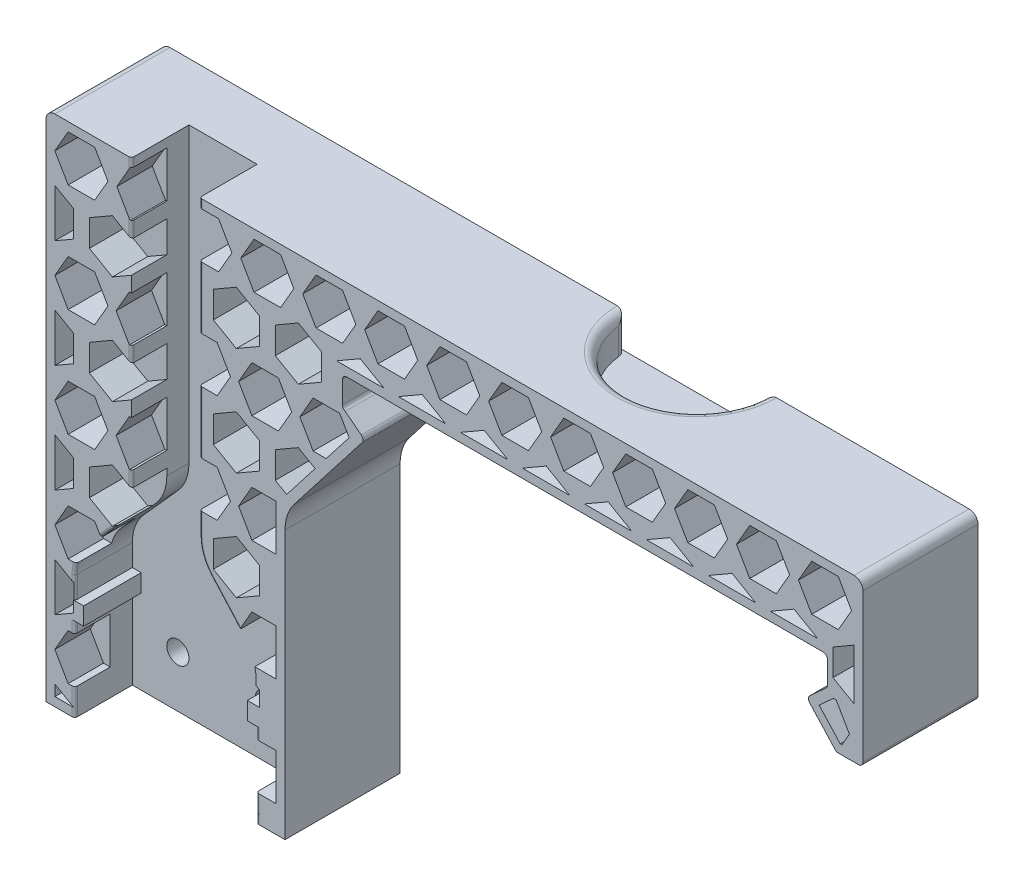
from build123d import *

# Parameters (mm, degrees)
BOSS_EXTRUDE1_DEPTH = 6.5
SKETCH3_R           = 1.25
CUT_EXTRUDE1_DEPTH  = 6.5
CUT_EXTRUDE4_DEPTH  = 4
BOSS_EXTRUDE2_DEPTH = 4
CUT_EXTRUDE5_DEPTH  = 4
FILLET3_R           = 1
FILLET5_R           = 0.3
SKETCH7_R           = 1.25
CUT_EXTRUDE6_DEPTH  = 10


with BuildPart() as part:
    # Sketch1 → Boss-Extrude1 (new, symmetric)
    with BuildSketch(Plane.XY):
        with BuildLine():
            Line((-19.159188309, 3.131905105), (34.640811691, 3.131905105))
            ThreePointArc((34.640811691, 3.131905105), (34.994365081, 2.985458495), (35.140811691, 2.631905105))
            Line((35.140811691, 2.631905105), (35.140811691, 0.151900089))
            ThreePointArc((35.140811691, 0.151900089), (35.098470899, -0.049465372), (34.978619495, -0.216726941))
            Line((34.978619495, -0.216726941), (33.150225729, -1.89225704))
            ThreePointArc((33.150225729, -1.89225704), (32.988508672, -2.239091587), (33.119406504, -2.598691874))
            Line((33.119406504, -2.598691874), (35.992179645, -5.733556779))
            ThreePointArc((35.992179645, -5.733556779), (36.159441214, -5.853408183), (36.360806675, -5.895748974))
            Line((36.360806675, -5.895748974), (38.640811691, -5.895748974))
            ThreePointArc((38.640811691, -5.895748974), (38.994365081, -5.749302365), (39.140811691, -5.395748974))
            Line((39.140811691, -5.395748974), (39.140811691, 11.375776068))
            ThreePointArc((39.140811691, 11.375776068), (38.847918472, 12.082882849), (38.140811691, 12.375776068))
            Line((38.140811691, 12.375776068), (-38.140811691, 12.375776068))
            Line((-38.140811691, 12.375776068), (-52.140811691, 12.375776068))
            ThreePointArc((-52.140811691, 12.375776068), (-52.847918472, 12.082882849), (-53.140811691, 11.375776068))
            Line((-53.140811691, 11.375776068), (-53.140811691, -45.624223932))
            Line((-53.140811691, -45.624223932), (-50.140811691, -45.624223932))
            Line((-50.140811691, -45.624223932), (-26.140811691, -45.624223932))
            Line((-26.140811691, -45.624223932), (-26.140811691, -15.3408971))
            ThreePointArc((-26.140811691, -15.3408971), (-25.870619915, -13.719504438), (-25.089246025, -12.273346562))
            Line((-25.089246025, -12.273346562), (-17.438945389, -2.426170674))
            ThreePointArc((-17.438945389, -2.426170674), (-17.337683774, -2.057127729), (-17.527033769, -1.724572186))
            Line((-17.527033769, -1.724572186), (-19.344726867, -0.312400938))
            ThreePointArc((-19.344726867, -0.312400938), (-19.573174589, -0.12848422), (-19.659188309, 0.151900089))
            Line((-19.659188309, 0.151900089), (-19.659188309, 2.631905105))
            ThreePointArc((-19.659188309, 2.631905105), (-19.5127417, 2.985458495), (-19.159188309, 3.131905105))
        make_face()
    extrude(amount=BOSS_EXTRUDE1_DEPTH, both=True)

    # Sketch3 → Cut-Extrude1 (cut)
    with BuildSketch(Plane.XY.offset(6.5)):
        with BuildLine():
            Line((-49.890811691, -36.124223932), (-49.890811691, -45.624223932))
            Line((-49.890811691, -45.624223932), (-29.390811691, -45.624223932))
            Line((-29.390811691, -45.624223932), (-29.390811691, -36.124223932))
            Line((-29.390811691, -36.124223932), (-30.390811691, -36.124223932))
            Line((-30.390811691, -36.124223932), (-30.390811691, -34.124223932))
            Line((-30.390811691, -34.124223932), (-29.390811691, -34.124223932))
            Line((-29.390811691, -34.124223932), (-29.390811691, -31.678365039))
            ThreePointArc((-29.390811691, -31.678365039), (-29.72081053, -29.892003049), (-30.667247356, -28.341440011))
            Line((-30.667247356, -28.341440011), (-34.514376026, -24.048556297))
            ThreePointArc((-34.514376026, -24.048556297), (-35.460812851, -22.49799326), (-35.790811691, -20.711631269))
            Line((-35.790811691, -20.711631269), (-35.790811691, 12.375776068))
            Line((-35.790811691, 12.375776068), (-43.490811691, 12.375776068))
            Line((-43.490811691, 12.375776068), (-43.490811691, -20.711631269))
            ThreePointArc((-43.490811691, -20.711631269), (-43.82081053, -22.49799326), (-44.767247356, -24.048556297))
            Line((-44.767247356, -24.048556297), (-48.614376026, -28.341440011))
            ThreePointArc((-48.614376026, -28.341440011), (-49.560812851, -29.892003049), (-49.890811691, -31.678365039))
            Line((-49.890811691, -31.678365039), (-49.890811691, -34.124223932))
            Line((-49.890811691, -34.124223932), (-48.890811691, -34.124223932))
            Line((-48.890811691, -34.124223932), (-48.890811691, -36.124223932))
            Line((-48.890811691, -36.124223932), (-49.890811691, -36.124223932))
        make_face()
        with Locations((-44.740811691, -39.824223932)):
            Circle(SKETCH3_R, mode=Mode.SUBTRACT)
        with Locations((-34.740811691, -39.824223932)):
            Circle(SKETCH3_R, mode=Mode.SUBTRACT)
    extrude(amount=-CUT_EXTRUDE1_DEPTH, mode=Mode.SUBTRACT)

    # Sketch2 → Cut-Extrude4 (cut)
    with BuildSketch(Plane.XY.offset(6.5)):
        Polygon((-34.238887902, -44.604986045), (-34.238887902, -44.624223932), (-29.042735479, -44.624223932), (-29.042735479, -44.604986045), (-31.640811691, -43.104986045), align=None)
        Polygon((-41.238887902, -44.604986045), (-41.238887902, -44.624223932), (-36.042735479, -44.624223932), (-36.042735479, -44.604986045), (-38.640811691, -43.104986045), align=None)
        Polygon((-48.238887902, -44.604986045), (-48.238887902, -44.624223932), (-43.042735479, -44.624223932), (-43.042735479, -44.604986045), (-45.640811691, -43.104986045), align=None)
        Polygon((-52.140811691, -43.39366118), (-52.140811691, -44.624223932), (-50.042735479, -44.624223932), (-50.042735479, -44.604986045), align=None)
        Polygon((-52.140811691, -40.006909834), (-50.640811691, -42.604986045), (-47.640811691, -42.604986045), (-46.140811691, -40.006909834), (-47.640811691, -37.408833623), (-50.640811691, -37.408833623), align=None)
        Polygon((-45.222083299, -40.006909834), (-43.722083299, -42.604986045), (-40.722083299, -42.604986045), (-39.222083299, -40.006909834), (-40.722083299, -37.408833623), (-43.722083299, -37.408833623), align=None)
        Polygon((-38.303354907, -40.006909834), (-36.803354907, -42.604986045), (-33.803354907, -42.604986045), (-32.303354907, -40.006909834), (-33.803354907, -37.408833623), (-36.803354907, -37.408833623), align=None)
        Polygon((-27.140811691, -37.408833623), (-29.884626515, -37.408833623), (-31.384626515, -40.006909834), (-29.884626515, -42.604986045), (-27.140811691, -42.604986045), align=None)
        Polygon((-34.238887902, -35.408833623), (-31.640811691, -36.908833623), (-29.042735479, -35.408833623), (-29.042735479, -32.408833623), (-31.640811691, -30.908833623), (-34.238887902, -32.408833623), align=None)
        Polygon((-41.238887902, -35.408833623), (-38.640811691, -36.908833623), (-36.042735479, -35.408833623), (-36.042735479, -32.408833623), (-38.640811691, -30.908833623), (-41.238887902, -32.408833623), align=None)
        Polygon((-48.238887902, -35.408833623), (-45.640811691, -36.908833623), (-43.042735479, -35.408833623), (-43.042735479, -32.408833623), (-45.640811691, -30.908833623), (-48.238887902, -32.408833623), align=None)
        Polygon((-50.042735479, -32.408833623), (-52.140811691, -31.197508757), (-52.140811691, -36.620158488), (-50.042735479, -35.408833623), align=None)
        Polygon((-52.140811691, -27.810757411), (-50.640811691, -30.408833623), (-47.640811691, -30.408833623), (-46.140811691, -27.810757411), (-47.640811691, -25.2126812), (-50.640811691, -25.2126812), align=None)
        Polygon((-45.222083299, -27.810757411), (-43.722083299, -30.408833623), (-40.722083299, -30.408833623), (-39.222083299, -27.810757411), (-40.722083299, -25.2126812), (-43.722083299, -25.2126812), align=None)
        Polygon((-38.303354907, -27.810757411), (-36.803354907, -30.408833623), (-33.803354907, -30.408833623), (-32.303354907, -27.810757411), (-33.803354907, -25.2126812), (-36.803354907, -25.2126812), align=None)
        Polygon((-27.140811691, -25.2126812), (-29.884626515, -25.2126812), (-31.384626515, -27.810757411), (-29.884626515, -30.408833623), (-27.140811691, -30.408833623), align=None)
        Polygon((-34.238887902, -23.2126812), (-31.640811691, -24.7126812), (-29.042735479, -23.2126812), (-29.042735479, -20.2126812), (-31.640811691, -18.7126812), (-34.238887902, -20.2126812), align=None)
        Polygon((-41.238887902, -23.2126812), (-38.640811691, -24.7126812), (-36.042735479, -23.2126812), (-36.042735479, -20.2126812), (-38.640811691, -18.7126812), (-41.238887902, -20.2126812), align=None)
        Polygon((-48.238887902, -23.2126812), (-45.640811691, -24.7126812), (-43.042735479, -23.2126812), (-43.042735479, -20.2126812), (-45.640811691, -18.7126812), (-48.238887902, -20.2126812), align=None)
        Polygon((-50.042735479, -20.2126812), (-52.140811691, -19.001356334), (-52.140811691, -24.424006065), (-50.042735479, -23.2126812), align=None)
        Polygon((-29.884626515, -18.2126812), (-27.140811691, -18.2126812), (-27.140811691, -13.016528777), (-29.884626515, -13.016528777), (-31.384626515, -15.614604989), align=None)
        Polygon((-27.238887902, -11.016528777), (-25.95501859, -11.75777107), (-22.737018764, -7.615684136), (-24.640811691, -6.516528777), (-27.238887902, -8.016528777), align=None)
        Polygon((-22.965898123, -6.016528777), (-21.494630144, -6.016528777), (-18.896603909, -2.672448261), (-19.965898123, -0.820376354), (-22.965898123, -0.820376354), (-24.465898123, -3.418452566), align=None)
        Polygon((-31.384626515, -3.418452566), (-29.884626515, -6.016528777), (-26.884626515, -6.016528777), (-25.384626515, -3.418452566), (-26.884626515, -0.820376354), (-29.884626515, -0.820376354), align=None)
        Polygon((-34.238887902, -11.016528777), (-31.640811691, -12.516528777), (-29.042735479, -11.016528777), (-29.042735479, -8.016528777), (-31.640811691, -6.516528777), (-34.238887902, -8.016528777), align=None)
        Polygon((-38.303354907, -15.614604989), (-36.803354907, -18.2126812), (-33.803354907, -18.2126812), (-32.303354907, -15.614604989), (-33.803354907, -13.016528777), (-36.803354907, -13.016528777), align=None)
        Polygon((-45.222083299, -15.614604989), (-43.722083299, -18.2126812), (-40.722083299, -18.2126812), (-39.222083299, -15.614604989), (-40.722083299, -13.016528777), (-43.722083299, -13.016528777), align=None)
        Polygon((-41.238887902, -11.016528777), (-38.640811691, -12.516528777), (-36.042735479, -11.016528777), (-36.042735479, -8.016528777), (-38.640811691, -6.516528777), (-41.238887902, -8.016528777), align=None)
        Polygon((-38.303354907, -3.418452566), (-36.803354907, -6.016528777), (-33.803354907, -6.016528777), (-32.303354907, -3.418452566), (-33.803354907, -0.820376354), (-36.803354907, -0.820376354), align=None)
        Polygon((-45.222083299, -3.418452566), (-43.722083299, -6.016528777), (-40.722083299, -6.016528777), (-39.222083299, -3.418452566), (-40.722083299, -0.820376354), (-43.722083299, -0.820376354), align=None)
        Polygon((-48.238887902, -11.016528777), (-45.640811691, -12.516528777), (-43.042735479, -11.016528777), (-43.042735479, -8.016528777), (-45.640811691, -6.516528777), (-48.238887902, -8.016528777), align=None)
        Polygon((-50.042735479, -8.016528777), (-52.140811691, -6.805203912), (-52.140811691, -12.227853643), (-50.042735479, -11.016528777), align=None)
        Polygon((-52.140811691, -3.418452566), (-50.640811691, -6.016528777), (-47.640811691, -6.016528777), (-46.140811691, -3.418452566), (-47.640811691, -0.820376354), (-50.640811691, -0.820376354), align=None)
        Polygon((-52.140811691, -15.614604989), (-50.640811691, -18.2126812), (-47.640811691, -18.2126812), (-46.140811691, -15.614604989), (-47.640811691, -13.016528777), (-50.640811691, -13.016528777), align=None)
        Polygon((34.194468368, -2.291703295), (36.58080166, -4.895748974), (36.762456006, -4.895748974), (37.615373485, -3.418452566), (36.115373485, -0.820376354), (35.800028906, -0.820376354), align=None)
        Polygon((38.140811691, 5.553543846), (38.140811691, -0.194296555), (35.761112098, 1.179623646), (35.761112098, 4.179623646), align=None)
        Polygon((31.859188309, 8.777699857), (33.359188309, 6.179623646), (36.359188309, 6.179623646), (37.859188309, 8.777699857), (36.359188309, 11.375776068), (33.359188309, 11.375776068), align=None)
        Polygon((24.859188309, 8.777699857), (26.359188309, 6.179623646), (29.359188309, 6.179623646), (30.859188309, 8.777699857), (29.359188309, 11.375776068), (26.359188309, 11.375776068), align=None)
        Polygon((17.859188309, 8.777699857), (19.359188309, 6.179623646), (22.359188309, 6.179623646), (23.859188309, 8.777699857), (22.359188309, 11.375776068), (19.359188309, 11.375776068), align=None)
        Polygon((10.859188309, 8.777699857), (12.359188309, 6.179623646), (15.359188309, 6.179623646), (16.859188309, 8.777699857), (15.359188309, 11.375776068), (12.359188309, 11.375776068), align=None)
        Polygon((3.859188309, 8.777699857), (5.359188309, 6.179623646), (8.359188309, 6.179623646), (9.859188309, 8.777699857), (8.359188309, 11.375776068), (5.359188309, 11.375776068), align=None)
        Polygon((-3.140811691, 8.777699857), (-1.640811691, 6.179623646), (1.359188309, 6.179623646), (2.859188309, 8.777699857), (1.359188309, 11.375776068), (-1.640811691, 11.375776068), align=None)
        Polygon((-10.140811691, 8.777699857), (-8.640811691, 6.179623646), (-5.640811691, 6.179623646), (-4.140811691, 8.777699857), (-5.640811691, 11.375776068), (-8.640811691, 11.375776068), align=None)
        Polygon((-17.140811691, 8.777699857), (-15.640811691, 6.179623646), (-12.640811691, 6.179623646), (-11.140811691, 8.777699857), (-12.640811691, 11.375776068), (-15.640811691, 11.375776068), align=None)
        Polygon((-24.140811691, 8.777699857), (-22.640811691, 6.179623646), (-19.640811691, 6.179623646), (-18.140811691, 8.777699857), (-19.640811691, 11.375776068), (-22.640811691, 11.375776068), align=None)
        Polygon((-27.238887902, 1.179623646), (-24.640811691, -0.320376354), (-22.042735479, 1.179623646), (-22.042735479, 4.179623646), (-24.640811691, 5.679623646), (-27.238887902, 4.179623646), align=None)
        Polygon((-34.238887902, 1.179623646), (-31.640811691, -0.320376354), (-29.042735479, 1.179623646), (-29.042735479, 4.179623646), (-31.640811691, 5.679623646), (-34.238887902, 4.179623646), align=None)
        Polygon((-31.140811691, 8.777699857), (-29.640811691, 6.179623646), (-26.640811691, 6.179623646), (-25.140811691, 8.777699857), (-26.640811691, 11.375776068), (-29.640811691, 11.375776068), align=None)
        Polygon((-38.140811691, 8.777699857), (-36.640811691, 6.179623646), (-33.640811691, 6.179623646), (-32.140811691, 8.777699857), (-33.640811691, 11.375776068), (-36.640811691, 11.375776068), align=None)
        Polygon((-41.238887902, 1.179623646), (-38.640811691, -0.320376354), (-36.042735479, 1.179623646), (-36.042735479, 4.179623646), (-38.640811691, 5.679623646), (-41.238887902, 4.179623646), align=None)
        Polygon((-48.238887902, 1.179623646), (-45.640811691, -0.320376354), (-43.042735479, 1.179623646), (-43.042735479, 4.179623646), (-45.640811691, 5.679623646), (-48.238887902, 4.179623646), align=None)
        Polygon((-45.140811691, 8.777699857), (-43.640811691, 6.179623646), (-40.640811691, 6.179623646), (-39.140811691, 8.777699857), (-40.640811691, 11.375776068), (-43.640811691, 11.375776068), align=None)
        Polygon((-52.140811691, 8.777699857), (-50.640811691, 6.179623646), (-47.640811691, 6.179623646), (-46.140811691, 8.777699857), (-47.640811691, 11.375776068), (-50.640811691, 11.375776068), align=None)
        Polygon((-50.042735479, 4.179623646), (-52.140811691, 5.390948511), (-52.140811691, -0.03170122), (-50.042735479, 1.179623646), align=None)
        Polygon((-20.238887902, 4.179623646), (-20.238887902, 4.131905105), (-15.042735479, 4.131905105), (-15.042735479, 4.179623646), (-17.640811691, 5.679623646), align=None)
        Polygon((-13.238887902, 4.179623646), (-13.238887902, 4.131905105), (-8.042735479, 4.131905105), (-8.042735479, 4.179623646), (-10.640811691, 5.679623646), align=None)
        Polygon((-6.238887902, 4.179623646), (-6.238887902, 4.131905105), (-1.042735479, 4.131905105), (-1.042735479, 4.179623646), (-3.640811691, 5.679623646), align=None)
        Polygon((0.761112098, 4.179623646), (0.761112098, 4.131905105), (5.957264521, 4.131905105), (5.957264521, 4.179623646), (3.359188309, 5.679623646), align=None)
        Polygon((7.761112098, 4.179623646), (7.761112098, 4.131905105), (12.957264521, 4.131905105), (12.957264521, 4.179623646), (10.359188309, 5.679623646), align=None)
        Polygon((28.761112098, 4.179623646), (28.761112098, 4.131905105), (33.957264521, 4.131905105), (33.957264521, 4.179623646), (31.359188309, 5.679623646), align=None)
        Polygon((21.761112098, 4.179623646), (21.761112098, 4.131905105), (26.957264521, 4.131905105), (26.957264521, 4.179623646), (24.359188309, 5.679623646), align=None)
        Polygon((14.761112098, 4.179623646), (14.761112098, 4.131905105), (19.957264521, 4.131905105), (19.957264521, 4.179623646), (17.359188309, 5.679623646), align=None)
    extrude(amount=-CUT_EXTRUDE4_DEPTH, mode=Mode.SUBTRACT)

    # Sketch5 → Boss-Extrude2 (add)
    with BuildSketch(Plane.XY.offset(2.5)):
        Polygon((-29.590811691, -34.124223932), (-29.042735479, -34.124223932), (-29.042735479, -36.124223932), (-29.390811691, -36.124223932), (-30.390811691, -36.124223932), (-30.390811691, -34.124223932), align=None)
    extrude(amount=BOSS_EXTRUDE2_DEPTH)

    # Sketch6 → Cut-Extrude5 (cut)
    with BuildSketch(Plane(origin=(0, 12.375776068, 0), x_dir=(1, 0, 0), z_dir=(0, 1, 0))):
        with BuildLine():
            Line((-0.605289562, 6.5), (15.394710438, 6.5))
            ThreePointArc((15.394710438, 6.5), (7.394710438, -1.5), (-0.605289562, 6.5))
        make_face()
    extrude(amount=-CUT_EXTRUDE5_DEPTH, mode=Mode.SUBTRACT)

    # Fillet3
    fillet3_edges = [part.edges().sort_by_distance(p)[0] for p in [
        (15.394710438, 10.375776068, -6.5),
        (-0.605289562, 10.375776068, -6.5),
        (7.394710438, 12.375776068, 1.5),
    ]]
    fillet(fillet3_edges, radius=FILLET3_R)

    # Fillet5
    # the kernel refuses this fillet: 0.3 mm, written as the material it takes off along each edge
    with BuildSketch(Plane(origin=(-44.890811691, -31.678365039, 6.5), x_dir=(-0.9184239702628125, 0.39559753645174855, 0), z_dir=(0.39559753645174855, 0.9184239702628125, 0))) as fillet5_piece_1:
        with BuildLine():
            CenterArc((5 + FILLET5_R, -FILLET5_R), FILLET5_R, 90, 90)
            Line((5, -FILLET5_R), (5, 0))
            Line((5, 0), (5 + FILLET5_R, 0))
        make_face()
    revolve(axis=Axis((-44.890811691, -31.678365039, 6.5), (0, 0, 1)), revolution_arc=23.303246089, mode=Mode.SUBTRACT)
    with BuildSketch(Plane(origin=(-49.890811691, -41.854986045, 6.5), x_dir=(-1, 0, 0), z_dir=(0, -1, 0))) as fillet5_piece_2:
        with BuildLine():
            CenterArc((FILLET5_R, FILLET5_R), FILLET5_R, 180, 90)
            Line((0, FILLET5_R), (0, 0))
            Line((0, 0), (FILLET5_R, 0))
        make_face()
    extrude(amount=4.519237886, mode=Mode.SUBTRACT)
    with BuildSketch(Plane(origin=(-49.890811691, -36.124223932, 6.5), x_dir=(-1, 0, 0), z_dir=(0, -1, 0)), Plane(origin=(-29.390811691, -38.158833623, 6.5), x_dir=(1, 0, 0), z_dir=(0, 1, 0))) as fillet5_piece_3:
        with BuildLine():
            CenterArc((FILLET5_R, FILLET5_R), FILLET5_R, 180, 90)
            Line((0, FILLET5_R), (0, 0))
            Line((0, 0), (FILLET5_R, 0))
        make_face()
    extrude(amount=2.034609691, mode=Mode.SUBTRACT)
    with BuildSketch(Plane(origin=(-49.890811691, -31.678365039, 6.5), x_dir=(-1, 0, 0), z_dir=(0, -1, 0))) as fillet5_piece_4:
        with BuildLine():
            CenterArc((FILLET5_R, FILLET5_R), FILLET5_R, 180, 90)
            Line((0, FILLET5_R), (0, 0))
            Line((0, 0), (FILLET5_R, 0))
        make_face()
    extrude(amount=2.445858892, mode=Mode.SUBTRACT)
    with BuildSketch(Plane(origin=(-44.563398205, -23.821087768, 6.5), x_dir=(-0.7447128670148646, 0.667385005602089, 0), z_dir=(-0.6673850056020891, -0.7447128670148647, 0))) as fillet5_piece_5:
        with BuildLine():
            CenterArc((FILLET5_R, FILLET5_R), FILLET5_R, 180, 90)
            Line((0, FILLET5_R), (0, 0))
            Line((0, 0), (FILLET5_R, 0))
        make_face()
    extrude(amount=4.286581196, mode=Mode.SUBTRACT)
    with BuildSketch(Plane(origin=(-43.490811691, -17.4626812, 6.5), x_dir=(-1, 0, 0), z_dir=(0, -1, 0)), Plane(origin=(-43.490811691, -5.266528777, 6.5), x_dir=(-1, 0, 0), z_dir=(0, -1, 0)), Plane(origin=(-43.490811691, 6.929623646, 6.5), x_dir=(-1, 0, 0), z_dir=(0, -1, 0))) as fillet5_piece_6:
        with BuildLine():
            CenterArc((FILLET5_R, FILLET5_R), FILLET5_R, 180, 90)
            Line((0, FILLET5_R), (0, 0))
            Line((0, 0), (FILLET5_R, 0))
        make_face()
    extrude(amount=3.241303079, mode=Mode.SUBTRACT)
    with BuildSketch(Plane(origin=(-43.490811691, 13.125776068, 6.5), x_dir=(-1, 0, 0), z_dir=(0, -1, 0)), Plane(origin=(-35.790811691, 10.625776068, 6.5), x_dir=(1, 0, 0), z_dir=(0, 1, 0)), Plane(origin=(-29.390811691, -46.374223932, 6.5), x_dir=(1, 0, 0), z_dir=(0, 1, 0))) as fillet5_piece_7:
        with BuildLine():
            CenterArc((FILLET5_R, FILLET5_R), FILLET5_R, 180, 90)
            Line((0, FILLET5_R), (0, 0))
            Line((0, 0), (FILLET5_R, 0))
        make_face()
    extrude(amount=2.5, mode=Mode.SUBTRACT)
    with BuildSketch(Plane(origin=(-35.790811691, -1.570376354, 6.5), x_dir=(1, 0, 0), z_dir=(0, 1, 0)), Plane(origin=(-35.790811691, -13.766528777, 6.5), x_dir=(1, 0, 0), z_dir=(0, 1, 0))) as fillet5_piece_8:
        with BuildLine():
            CenterArc((FILLET5_R, FILLET5_R), FILLET5_R, 180, 90)
            Line((0, FILLET5_R), (0, 0))
            Line((0, 0), (FILLET5_R, 0))
        make_face()
    extrude(amount=8.5, mode=Mode.SUBTRACT)
    with BuildSketch(Plane(origin=(-35.790811691, -20.711631269, 6.5), x_dir=(1, 0, 0), z_dir=(0, 1, 0))) as fillet5_piece_9:
        with BuildLine():
            CenterArc((FILLET5_R, FILLET5_R), FILLET5_R, 180, 90)
            Line((0, FILLET5_R), (0, 0))
            Line((0, 0), (FILLET5_R, 0))
        make_face()
    extrude(amount=3.248950069, mode=Mode.SUBTRACT)
    with BuildSketch(Plane(origin=(-29.390811691, -45.154024151, 6.5), x_dir=(1, 0, 0), z_dir=(0, 1, 0))) as fillet5_piece_10:
        with BuildLine():
            CenterArc((FILLET5_R, FILLET5_R), FILLET5_R, 180, 90)
            Line((0, FILLET5_R), (0, 0))
            Line((0, 0), (FILLET5_R, 0))
        make_face()
    extrude(amount=3.299038106, mode=Mode.SUBTRACT)
    with BuildSketch(Plane(origin=(-30.789345878, -28.205194307, 6.5), x_dir=(0.7447128670148618, 0.6673850056020922, 0), z_dir=(-0.6673850056020924, 0.744712867014862, 0))) as fillet5_piece_11:
        with BuildLine():
            CenterArc((FILLET5_R, FILLET5_R), FILLET5_R, 180, 90)
            Line((0, FILLET5_R), (0, 0))
            Line((0, 0), (FILLET5_R, 0))
        make_face()
    extrude(amount=5.581531076, mode=Mode.SUBTRACT)
    with BuildSketch(Plane(origin=(-30.790811691, -20.711631269, 6.5), x_dir=(-0.7447128670148535, -0.6673850056021017, 0), z_dir=(0.6673850056021017, -0.7447128670148535, 0))) as fillet5_piece_12:
        with BuildLine():
            CenterArc((5 - FILLET5_R, FILLET5_R), FILLET5_R, 270, 90)
            Line((5, FILLET5_R), (5, 0))
            Line((5, 0), (5 - FILLET5_R, 0))
        make_face()
    revolve(axis=Axis((-30.790811691, -20.711631269, 6.5), (0, 0, -1)), revolution_arc=41.865557693, mode=Mode.SUBTRACT)

    # Sketch7 → Cut-Extrude6 (cut)
    with BuildSketch(Plane.XY.offset(6.5)):
        with Locations((-44.740811691, -39.824223932)):
            Circle(SKETCH7_R)
        with Locations((-34.740811691, -39.824223932)):
            Circle(SKETCH7_R)
    extrude(amount=-CUT_EXTRUDE6_DEPTH, mode=Mode.SUBTRACT)


solid = part.part
